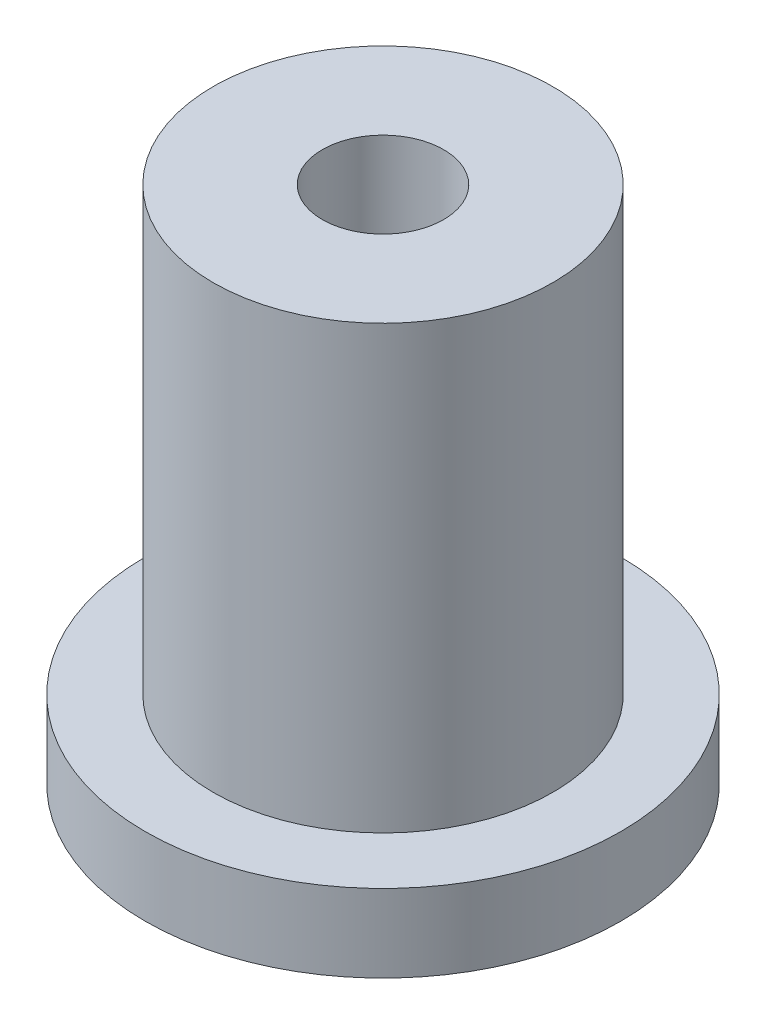
from build123d import *


# Read off the part's stored shape, not the designer's step: PerçageAvancé1
with BuildPart() as part:
    # Esquisse1 → Révolution1 (revolve)
    with BuildSketch(Plane.XY, mode=Mode.PRIVATE) as r_volution1_sk:
        Polygon((0, -43.792727273), (0, -97.272727273), (-24.5, -97.272727273), (-24.5, -89.272727273), (-17.5, -89.272727273), (-17.5, -43.792727273), align=None)
    revolve(r_volution1_sk.sketch.rotate(Axis((0, 115.909090909, 0), (0, -1, 0)), 270), axis=Axis((0, 115.909090909, 0), (0, -1, 0)))

    # PerçageAvancé1 outline → PerçageAvancé1 (revolve, cut)
    with BuildSketch(Plane.XY):
        Polygon((0, -77.548106142), (6.25, -73.792727273), (6.25, -43.792727273), (0, -43.792727273), align=None)
    revolve(axis=Axis((0, 0, 0), (0, 1, 0)), mode=Mode.SUBTRACT)


solid = part.part
